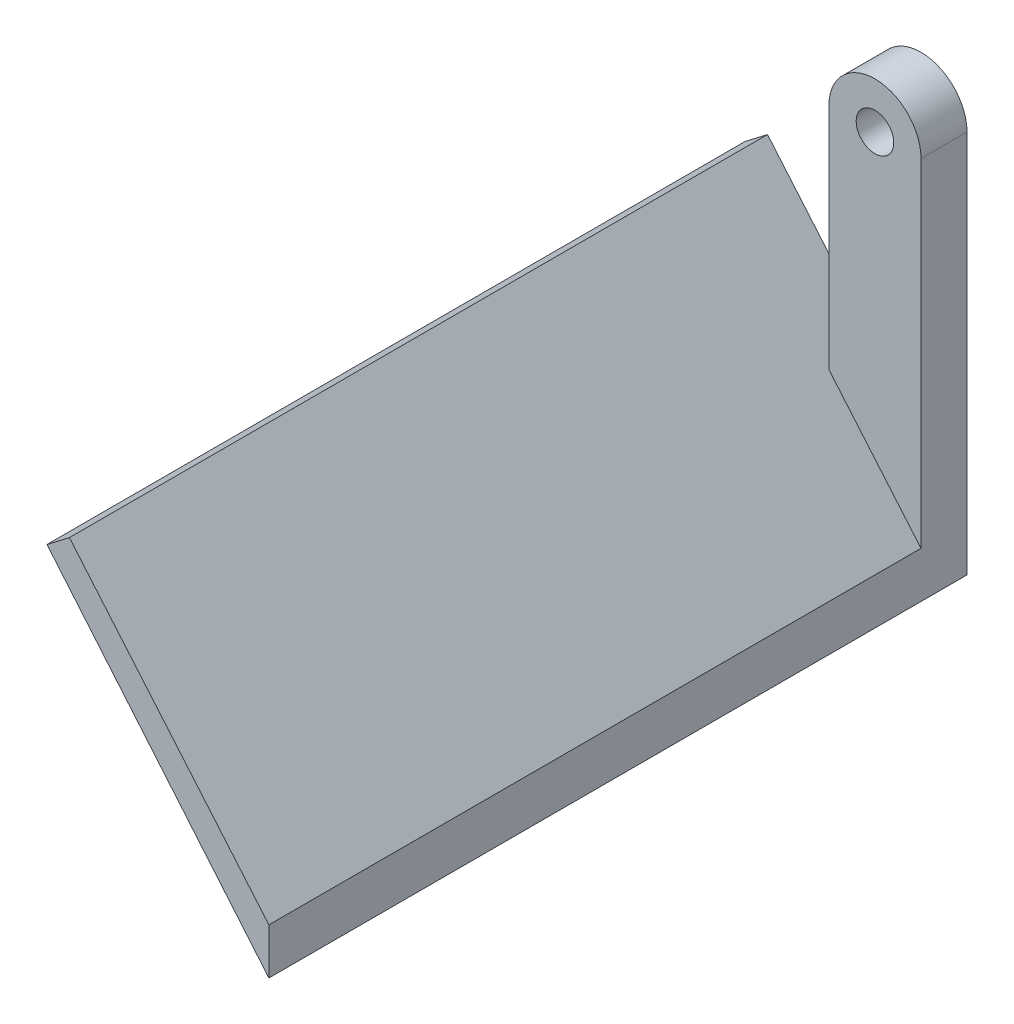
from build123d import *

# Parameters (mm, degrees)
CROQUIS2_R              = 2.45
SALIENTE_EXTRUIR1_DEPTH = 6
SALIENTE_EXTRUIR2_DEPTH = 91


with BuildPart() as part:
    # Croquis2 → Saliente-Extruir1 (new body)
    with BuildSketch(Plane(origin=(0, 0, -1991.883018812), x_dir=(-1, 0, 0), z_dir=(0, 0, -1))):
        with BuildLine():
            Line((-11.1, 0), (-11.1, -50))
            Line((-11.1, -50), (0.9, -50))
            Line((0.9, -50), (0.9, 0))
            ThreePointArc((0.9, 0), (-5.1, 6), (-11.1, 0))
        make_face()
        with Locations((-5.1, 0)):
            Circle(CROQUIS2_R, mode=Mode.SUBTRACT)
    extrude(amount=SALIENTE_EXTRUIR1_DEPTH)

    # Croquis3 → Saliente-Extruir2 (add)
    with BuildSketch(Plane(origin=(0, 0, -1997.883018812), x_dir=(-1, 0, 0), z_dir=(0, 0, -1))):
        Polygon((-11.1, -50), (17.825442436, -15.52800006), (14.903598687, -13.287396749), (-11.1, -44), align=None)
    extrude(amount=-SALIENTE_EXTRUIR2_DEPTH)


solid = part.part
